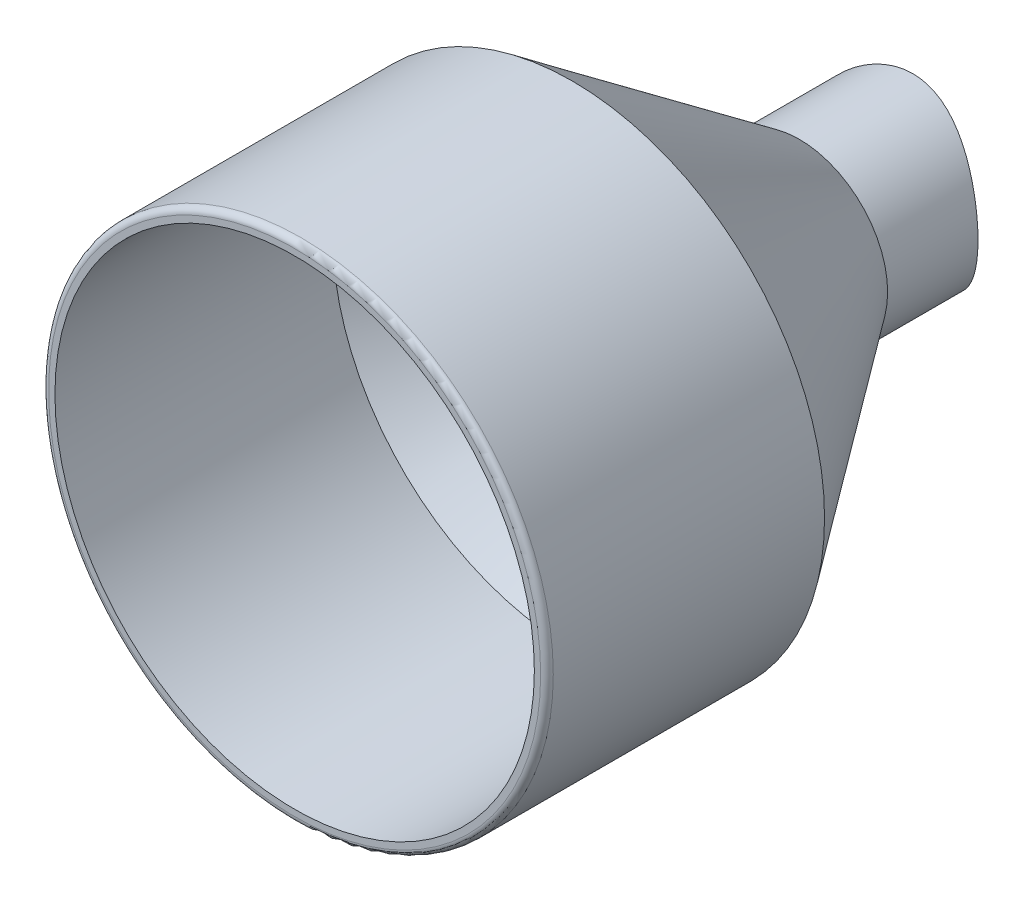
from build123d import *
from build123d.topology import SkipClean

# Parameters (mm, degrees)
SKETCH1_R               = 20
SKETCH1_R_2             = 19
BOSS_EXTRUDE1_DEPTH     = 22
FILLET1_R               = 0.5
SKETCH5_W               = 9
SKETCH5_H               = 1
CUT_EXTRUDE1_DEPTH      = 10
CUT_EXTRUDE1_DEPTH_BACK = 10
SKETCH6_R               = 14.25
BOSS_EXTRUDE2_START     = -44
BOSS_EXTRUDE2_DEPTH     = 4
CHAMFER1_SIZE           = 1


with BuildPart() as part:
    # Sketch1 → Boss-Extrude1 (new body)
    with BuildSketch(Plane.XY):
        Circle(SKETCH1_R)
        Circle(SKETCH1_R_2, mode=Mode.SUBTRACT)
    extrude(amount=BOSS_EXTRUDE1_DEPTH)

    # Fillet1
    fillet1_edges = [part.edges().sort_by_distance(p)[0] for p in [
        (-20, 0, 22),
    ]]
    fillet(fillet1_edges, radius=FILLET1_R)

    # Sketch5 → Revolve1 (revolve)
    with BuildSketch(Plane(origin=(0, 0, 0), x_dir=(0, 0, -1), z_dir=(1, 0, 0)), mode=Mode.PRIVATE) as revolve1_sk:
        Polygon((0, 19), (18, 6), (18, 7), (0, 20), align=None)
        with Locations((22.5, 6.5)):
            Rectangle(SKETCH5_W, SKETCH5_H)
    revolve(revolve1_sk.sketch.rotate(Axis((0, 0, 0), (0, 0, -1)), 90), axis=Axis((0, 0, 0), (0, 0, -1)))

    # Sketch6 → Cut-Extrude1 (cut, two sides: drawn at the far end of the back side and taken through both)
    with BuildSketch(Plane(origin=(0, 0, 0), x_dir=(0, 0, -1), z_dir=(1, 0, 0)).offset(-CUT_EXTRUDE1_DEPTH_BACK)):
        with Locations((39.412191587, 0)):
            Circle(SKETCH6_R)
    extrude(amount=CUT_EXTRUDE1_DEPTH + CUT_EXTRUDE1_DEPTH_BACK, mode=Mode.SUBTRACT)

    # Sketch7 → Boss-Extrude2 (add)
    with SkipClean():  # the faces are left unmerged after this step: merging them gives an invalid solid
        with BuildSketch(Plane.XY.offset(22).offset(BOSS_EXTRUDE2_START)):
            with BuildLine():
                Line((-6.92820323, -1), (-5, -1))
                Line((-5, -1), (-5, 1))
                Line((-5, 1), (-6.92820323, 1))
                ThreePointArc((-6.92820323, 1), (-6.982027736, 0.501287038), (-7, 0))
                ThreePointArc((-7, 0), (-6.982027736, -0.501287038), (-6.92820323, -1))
            make_face()
            with BuildLine():
                Line((5, -1), (6.92820323, -1))
                ThreePointArc((6.92820323, -1), (6.982027736, -0.501287038), (7, 0))
                ThreePointArc((7, 0), (6.982027736, 0.501287038), (6.92820323, 1))
                Line((6.92820323, 1), (5, 1))
                Line((5, 1), (5, -1))
            make_face()
        extrude(amount=BOSS_EXTRUDE2_DEPTH)

    # Chamfer1
    chamfer1_edges = [part.edges().sort_by_distance(p)[0] for p in [
        (-5, 0, -22),
        (5, 0, -22),
    ]]
    chamfer(chamfer1_edges, length=CHAMFER1_SIZE - 0.0001)  # a hair under: the kernel refuses the full size


solid = part.part
